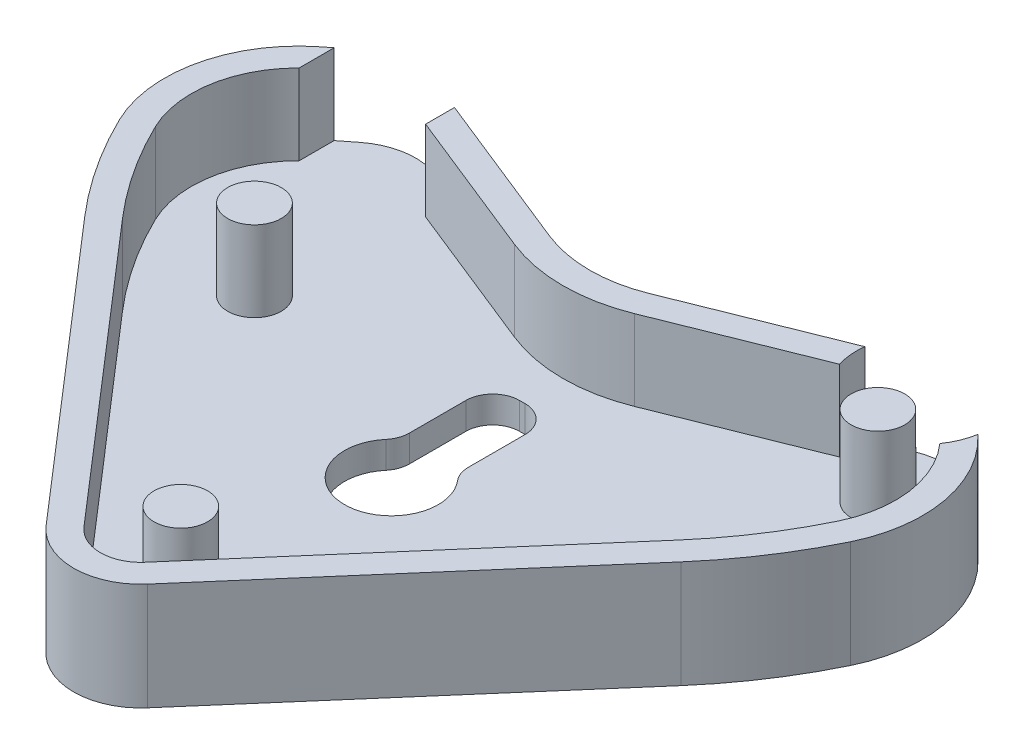
from build123d import *

# Parameters (mm, degrees)
SALIENTE_EXTRUIR1_DEPTH = 8
REDONDEO3_R             = 5
REDONDEO4_R             = 5
REDONDEO5_R             = 35
REDONDEO6_R             = 10
REDONDEO7_R             = 10
VACIADO1_T              = -2
CROQUIS2_R              = 2
SALIENTE_EXTRUIR2_DEPTH = 6
CROQUIS3_R              = 5
CORTAR_EXTRUIR1_DEPTH   = 10
CROQUIS4_R              = 2
SALIENTE_EXTRUIR4_DEPTH = 6
CORTAR_EXTRUIR2_START   = 10
CORTAR_EXTRUIR2_DEPTH   = 10
CROQUIS6_R              = 2
SALIENTE_EXTRUIR5_DEPTH = 6
CROQUIS7_R              = 2.5
CORTAR_EXTRUIR3_DEPTH   = 10
CORTAR_EXTRUIR4_DEPTH   = 5
REDONDEO8_R             = 2


with BuildPart() as part:
    # Croquis1 → Saliente-Extruir1 (new body)
    with BuildSketch(Plane(origin=(0, 0, 0), x_dir=(1, 0, 0), z_dir=(0, 1, 0))):
        Polygon((-30, 0), (-30, 6.559995295), (-20.5612792, 13.970160587), (0, 5.719083833), (20.5612792, 13.970160587), (30, 6.559995295), (30, 0), (0, -34.662162162), align=None)
    extrude(amount=SALIENTE_EXTRUIR1_DEPTH)

    # Redondeo3
    redondeo3_edges = [part.edges().sort_by_distance(p)[0] for p in [
        (0, 4, 34.662162162),
    ]]
    fillet(redondeo3_edges, radius=REDONDEO3_R)

    # Redondeo4
    redondeo4_edges = [part.edges().sort_by_distance(p)[0] for p in [
        (-20.5612792, 4, -13.970160587),
        (20.5612792, 4, -13.970160587),
    ]]
    fillet(redondeo4_edges, radius=REDONDEO4_R)

    # Redondeo5
    # the kernel refuses this fillet: 35 mm, written as the material it takes off along each edge
    with BuildSketch(Plane(origin=(-30, -29.587762227, 0), x_dir=(0.6544253650435297, 0, 0.7561266042056997), z_dir=(0, 1, 0))) as redondeo5_piece_1:
        with BuildLine():
            CenterArc((11.835104891, 35), REDONDEO5_R, 241.323383223, 28.676616777)
            Line((-4.960186966, 4.293027316), (-5.296092803, 3.678887862))
            ThreePointArc((-5.296092803, 3.678887862), (-2.938191238, 1.617225035), (-0.458097756, -0.529288623))
            Line((-0.458097756, -0.529288623), (0, -0.7))
            Line((0, -0.7), (11.835104891, -0.7))
            Line((11.835104891, -0.7), (11.835104891, 0))
        make_face()
    extrude(amount=67.175524454, mode=Mode.SUBTRACT)
    with BuildSketch(Plane(origin=(30, -29.587762227, 0), x_dir=(0, 0, -1), z_dir=(0, 1, 0))) as redondeo5_piece_2:
        with BuildLine():
            CenterArc((13.956050105, 34.209623986), REDONDEO5_R, 229.12390756, 28.676616777)
            Line((-8.948837672, 7.745192839), (-9.406935427, 7.215904216))
            Line((-9.406935427, 7.215904216), (-0.458097756, -0.529288623))
            Line((-0.458097756, -0.529288623), (0, -0.7))
            ThreePointArc((0, -0.7), (3.279997647, -0.7), (6.412074199, -0.68419248))
            Line((6.412074199, -0.68419248), (6.559995295, 0))
        make_face()
    extrude(amount=67.175524454, mode=Mode.SUBTRACT)

    # Redondeo6
    redondeo6_edges = [part.edges().sort_by_distance(p)[0] for p in [
        (-30, 4, -6.559995295),
        (30, 4, -6.559995295),
    ]]
    fillet(redondeo6_edges, radius=REDONDEO6_R)

    # Redondeo7
    redondeo7_edges = [part.edges().sort_by_distance(p)[0] for p in [
        (0, 4, -5.719083833),
    ]]
    fillet(redondeo7_edges, radius=REDONDEO7_R)

    # Vaciado1
    vaciado1_openings = [part.faces().sort_by_distance(p)[0] for p in [
        (0, 8, 5.527661799),
    ]]
    offset(amount=VACIADO1_T, openings=vaciado1_openings, kind=Kind.INTERSECTION)

    # Croquis2 → Saliente-Extruir2 (add, through all)
    with BuildSketch(Plane(origin=(0, 2, 0), x_dir=(1, 0, 0), z_dir=(0, 1, 0))):
        with Locations(Location((0, -24.021871509, 0), (0, 0, 90))):
            Circle(CROQUIS2_R)
    extrude(amount=SALIENTE_EXTRUIR2_DEPTH)

    # Croquis3 → Cortar-Extruir1 (cut)
    with BuildSketch(Plane(origin=(0, 2, 0), x_dir=(1, 0, 0), z_dir=(0, 1, 0))):
        with Locations((20.168821407, 11.224565194)):
            Circle(CROQUIS3_R)
    extrude(amount=CORTAR_EXTRUIR1_DEPTH, mode=Mode.SUBTRACT)

    # Croquis4 → Saliente-Extruir4 (add, through all)
    with BuildSketch(Plane(origin=(0, 2, 0), x_dir=(1, 0, 0), z_dir=(0, 1, 0))):
        with Locations(Location((19.744313659, 8.254751535, 0), (0, 0, 90))):
            Circle(CROQUIS4_R)
    extrude(amount=SALIENTE_EXTRUIR4_DEPTH)

    # Croquis5 → Cortar-Extruir2 (cut)
    with BuildSketch(Plane(origin=(0, 2, 0), x_dir=(1, 0, 0), z_dir=(0, 1, 0)).offset(CORTAR_EXTRUIR2_START)):
        with BuildLine():
            Line((-23.915581781, 14.17421255), (-23.915581781, 8.72634885))
            ThreePointArc((-23.915581781, 8.72634885), (-23.578448406, 9.04178192), (-23.22368003, 9.33724145))
            Line((-23.22368003, 9.33724145), (-21.596854982, 10.614431735))
            ThreePointArc((-21.596854982, 10.614431735), (-20.168821407, 11.224565194), (-18.627041323, 11.038939482))
            Line((-18.627041323, 11.038939482), (-15.564418219, 9.809933346))
            Line((-15.564418219, 9.809933346), (-15.564418219, 14.17421255))
            Line((-15.564418219, 14.17421255), (-23.915581781, 14.17421255))
        make_face()
    extrude(amount=-CORTAR_EXTRUIR2_DEPTH, mode=Mode.SUBTRACT)

    # Croquis6 → Saliente-Extruir5 (add, through all)
    with BuildSketch(Plane(origin=(0, 2, 0), x_dir=(1, 0, 0), z_dir=(0, 1, 0))):
        with Locations(Location((-16.8551421, -1.672109492, 0), (0, 0, 90))):
            Circle(CROQUIS6_R)
    extrude(amount=SALIENTE_EXTRUIR5_DEPTH)

    # Croquis7 → Cortar-Extruir3 (cut)
    with BuildSketch(Plane(origin=(0, 2, 0), x_dir=(1, 0, 0), z_dir=(0, 1, 0))):
        with Locations(Location((0, -8.30592839, 0), (0, 0, 270))):
            Circle(CROQUIS7_R)
    extrude(amount=-CORTAR_EXTRUIR3_DEPTH, mode=Mode.SUBTRACT)

    # Croquis8 → Cortar-Extruir4 (cut)
    with BuildSketch(Plane(origin=(0, 2, 0), x_dir=(1, 0, 0), z_dir=(0, 1, 0))):
        with BuildLine():
            Line((2.20642721, 1.459281861), (-2.20642721, 1.459281861))
            Line((-2.20642721, 1.459281861), (-2.20642721, -5.589003848))
            ThreePointArc((-2.20642721, -5.589003848), (0, -4.80592839), (2.20642721, -5.589003848))
            Line((2.20642721, -5.589003848), (2.20642721, 1.459281861))
        make_face()
        with BuildLine():
            ThreePointArc((2.20642721, -5.589003848), (0, -4.80592839), (-2.20642721, -5.589003848))
            Line((-2.20642721, -5.589003848), (-2.20642721, -7.130479979))
            ThreePointArc((-2.20642721, -7.130479979), (0, -5.80592839), (2.20642721, -7.130479979))
            Line((2.20642721, -7.130479979), (2.20642721, -5.589003848))
        make_face()
        with BuildLine():
            Line((-2.20642721, -7.130479979), (-2.20642721, -5.589003848))
            ThreePointArc((-2.20642721, -5.589003848), (-1.504577144, -11.46603086), (3.5, -8.30592839))
            ThreePointArc((3.5, -8.30592839), (3.160102469, -6.801351246), (2.20642721, -5.589003848))
            Line((2.20642721, -5.589003848), (2.20642721, -7.130479979))
            ThreePointArc((2.20642721, -7.130479979), (2.425496653, -7.700151214), (2.5, -8.30592839))
            ThreePointArc((2.5, -8.30592839), (-0.605777176, -10.731425043), (-2.20642721, -7.130479979))
        make_face()
    extrude(amount=-CORTAR_EXTRUIR4_DEPTH, mode=Mode.SUBTRACT)

    # Redondeo8
    redondeo8_edges = [part.edges().sort_by_distance(p)[0] for p in [
        (-2.20642721, 1, 5.589003848),
        (-2.20642721, 1, -1.459281861),
        (2.20642721, 1, -1.459281861),
        (2.20642721, 1, 5.589003848),
    ]]
    fillet(redondeo8_edges, radius=REDONDEO8_R)


solid = part.part
